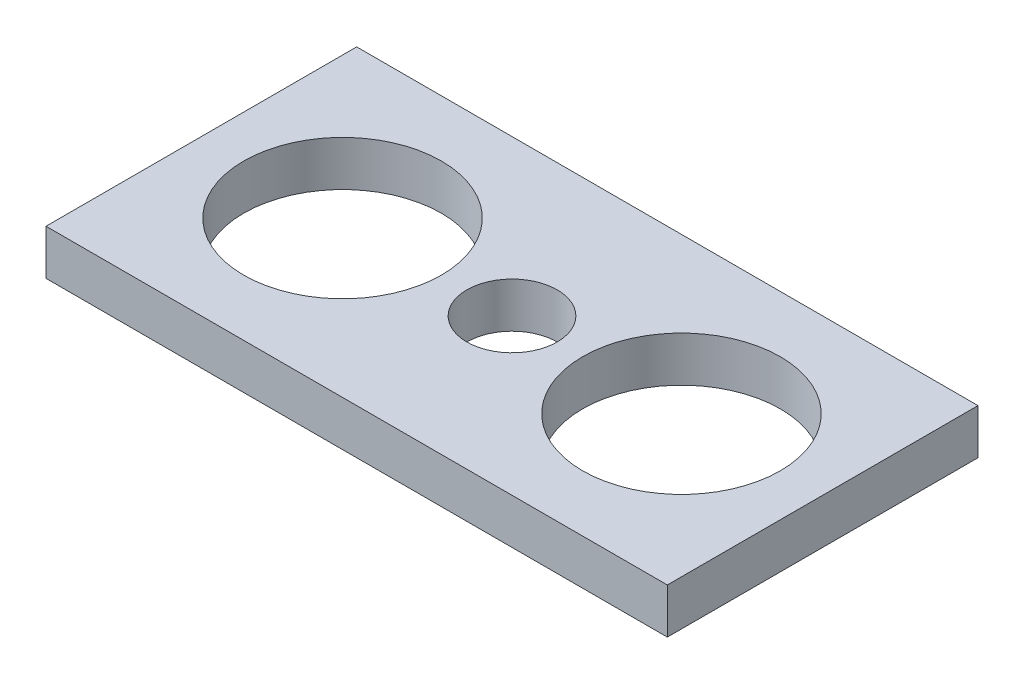
from build123d import *

# Parameters (mm, degrees)
SKETCH2_W           = 220
SKETCH2_H           = 110
SKETCH2_R           = 35
SKETCH2_R_2         = 16
BOSS_EXTRUDE1_DEPTH = 16


with BuildPart() as part:
    # Sketch2 → Boss-Extrude1 (new body)
    with BuildSketch(Plane(origin=(0, 0, 0), x_dir=(1, 0, 0), z_dir=(0, 1, 0))):
        with Locations((110, 55)):
            Rectangle(SKETCH2_W, SKETCH2_H)
        with Locations((50, 55)):
            Circle(SKETCH2_R, mode=Mode.SUBTRACT)
        with Locations((170, 55)):
            Circle(SKETCH2_R, mode=Mode.SUBTRACT)
        with Locations((110, 55)):
            Circle(SKETCH2_R_2, mode=Mode.SUBTRACT)
    extrude(amount=BOSS_EXTRUDE1_DEPTH)


solid = part.part
